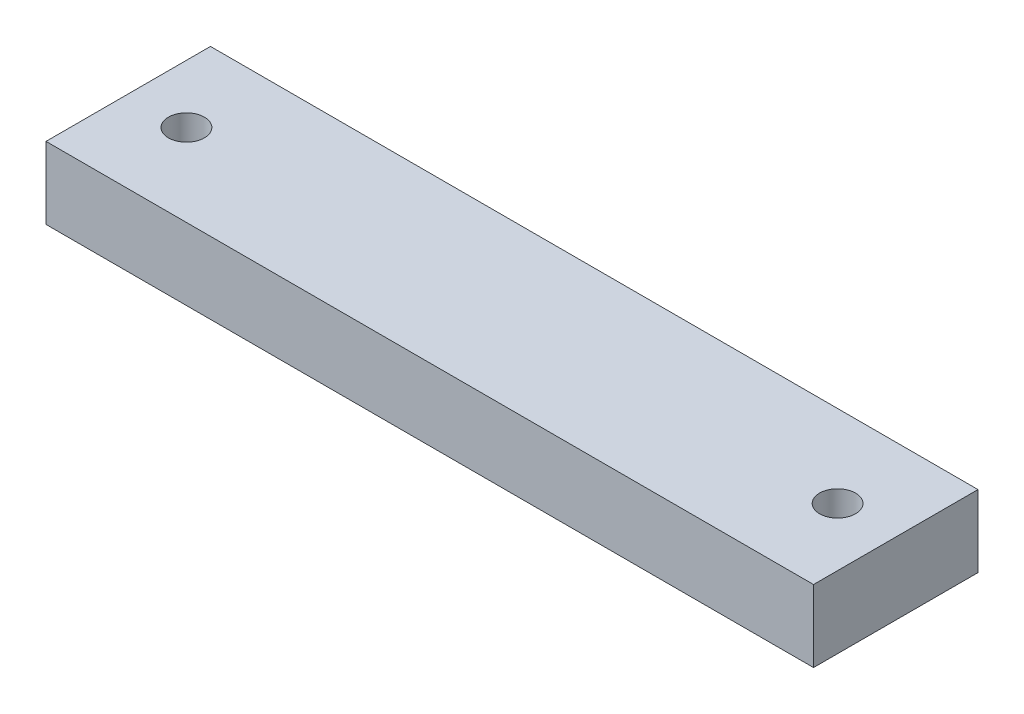
from build123d import *

# Parameters (mm, degrees)
SKETCH1_W           = 106.68
SKETCH1_H           = 22.86
SKETCH1_R           = 2.5
BOSS_EXTRUDE1_DEPTH = 10


with BuildPart() as part:
    # Sketch1 → Boss-Extrude1 (new body)
    with BuildSketch(Plane(origin=(0, 0, 0), x_dir=(1, 0, 0), z_dir=(0, 1, 0))):
        with Locations((53.34, 11.43)):
            Rectangle(SKETCH1_W, SKETCH1_H)
        with Locations((8.0899, 11.43)):
            Circle(SKETCH1_R, mode=Mode.SUBTRACT)
        with Locations((98.5901, 11.43)):
            Circle(SKETCH1_R, mode=Mode.SUBTRACT)
    extrude(amount=BOSS_EXTRUDE1_DEPTH)


solid = part.part
